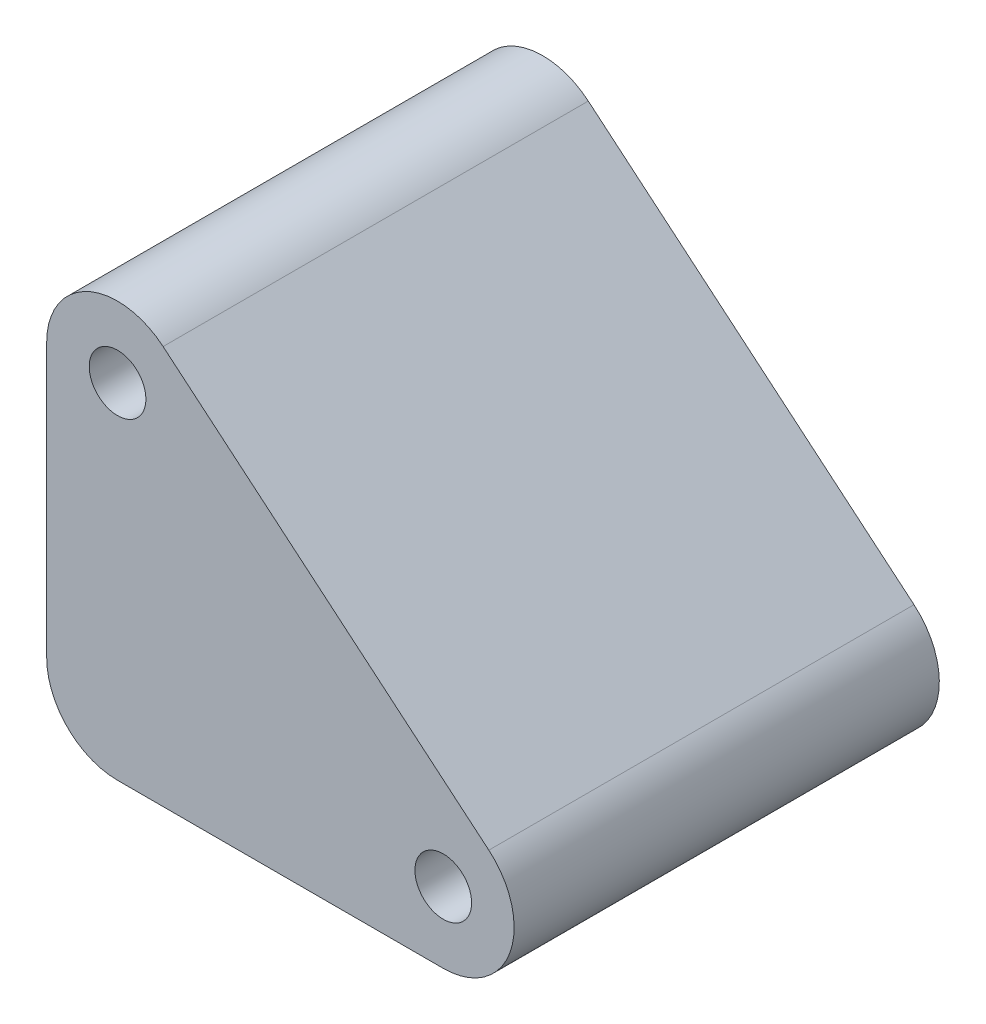
from build123d import *

# Parameters (mm, degrees)
BOSS_EXTRUDE1_DEPTH      = 15
BOSS_EXTRUDE1_DEPTH_BACK = 15
SKETCH1_R                = 2


with BuildPart() as part:
    # Sketch1 → Boss-Extrude1 (new, two sides: drawn at the far end of the back side and taken through both)
    with BuildSketch(Plane.XY.offset(-BOSS_EXTRUDE1_DEPTH_BACK)):
        with BuildLine():
            Line((-256.574339732, 135.388338696), (-233.593006439, 116.104710406))
            ThreePointArc((-233.593006439, 116.104710406), (-232.108481383, 110.564387474), (-236.806944487, 107.27448819))
            Line((-236.806944487, 107.27448819), (-259.788277781, 107.27448819))
            ThreePointArc((-259.788277781, 107.27448819), (-263.323811687, 108.738954284), (-264.788277781, 112.27448819))
            Line((-264.788277781, 112.27448819), (-264.788277781, 131.558116481))
            ThreePointArc((-264.788277781, 131.558116481), (-261.901369089, 136.089655416), (-256.574339732, 135.388338696))
        make_face()
        with Locations((-236.806944487, 112.27448819)):
            Circle(SKETCH1_R, mode=Mode.SUBTRACT)
        with Locations((-259.788277781, 131.558116481)):
            Circle(SKETCH1_R, mode=Mode.SUBTRACT)
    extrude(amount=BOSS_EXTRUDE1_DEPTH + BOSS_EXTRUDE1_DEPTH_BACK)


solid = part.part
